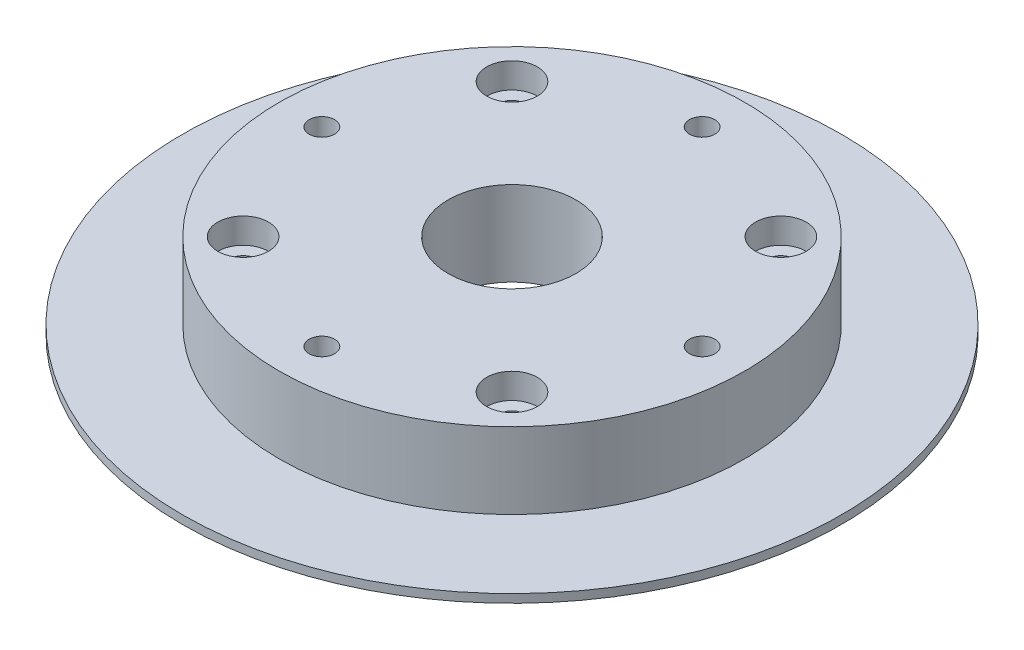
from build123d import *

# Parameters (mm, degrees)
SKETCH1_R           = 39
SKETCH1_R_2         = 1.5
SKETCH1_R_3         = 7.5635
BOSS_EXTRUDE1_DEPTH = 1
BOSS_EXTRUDE2_START = 9
SKETCH1_3_R         = 27.55
SKETCH1_3_R_2       = 1.5
SKETCH1_3_R_3       = 7.5635
BOSS_EXTRUDE2_DEPTH = 9
SKETCH2_R           = 3
SKETCH2_R_2         = 1.5
CUT_EXTRUDE1_DEPTH  = 3


with BuildPart() as part:
    # Sketch1 → Boss-Extrude1 (new body)
    with BuildSketch(Plane(origin=(0, 0, 0), x_dir=(1, 0, 0), z_dir=(0, 1, 0))):
        Circle(SKETCH1_R)
        with Locations((22.5, 0)):
            Circle(SKETCH1_R_2, mode=Mode.SUBTRACT)
        with Locations((-15.909902577, -15.909902577)):
            Circle(SKETCH1_R_2, mode=Mode.SUBTRACT)
        with Locations((0, -22.5)):
            Circle(SKETCH1_R_2, mode=Mode.SUBTRACT)
        with Locations((15.909902577, -15.909902577)):
            Circle(SKETCH1_R_2, mode=Mode.SUBTRACT)
        with Locations((-22.5, 0)):
            Circle(SKETCH1_R_2, mode=Mode.SUBTRACT)
        with Locations((-15.909902577, 15.909902577)):
            Circle(SKETCH1_R_2, mode=Mode.SUBTRACT)
        with Locations((0, 22.5)):
            Circle(SKETCH1_R_2, mode=Mode.SUBTRACT)
        Circle(SKETCH1_R_3, mode=Mode.SUBTRACT)
        with Locations((15.909902577, 15.909902577)):
            Circle(SKETCH1_R_2, mode=Mode.SUBTRACT)
    extrude(amount=-BOSS_EXTRUDE1_DEPTH)

    # Sketch1<3> → Boss-Extrude2 (add)
    with BuildSketch(Plane(origin=(0, 0, 0), x_dir=(1, 0, 0), z_dir=(0, 1, 0)).offset(BOSS_EXTRUDE2_START)):
        Circle(SKETCH1_3_R)
        with Locations((-15.909902577, -15.909902577)):
            Circle(SKETCH1_3_R_2, mode=Mode.SUBTRACT)
        with Locations((0, -22.5)):
            Circle(SKETCH1_3_R_2, mode=Mode.SUBTRACT)
        with Locations((15.909902577, -15.909902577)):
            Circle(SKETCH1_3_R_2, mode=Mode.SUBTRACT)
        with Locations((-22.5, 0)):
            Circle(SKETCH1_3_R_2, mode=Mode.SUBTRACT)
        with Locations((-15.909902577, 15.909902577)):
            Circle(SKETCH1_3_R_2, mode=Mode.SUBTRACT)
        with Locations((0, 22.5)):
            Circle(SKETCH1_3_R_2, mode=Mode.SUBTRACT)
        Circle(SKETCH1_3_R_3, mode=Mode.SUBTRACT)
        with Locations((15.909902577, 15.909902577)):
            Circle(SKETCH1_3_R_2, mode=Mode.SUBTRACT)
        with Locations((22.5, 0)):
            Circle(SKETCH1_3_R_2, mode=Mode.SUBTRACT)
    extrude(amount=-BOSS_EXTRUDE2_DEPTH)

    # Sketch2 → Cut-Extrude1 (cut)
    # profile 1 of 4: a face of its own
    with BuildSketch(Plane(origin=(0, 9, 0), x_dir=(1, 0, 0), z_dir=(0, 1, 0))):
        with Locations((15.909902577, 15.909902577)):
            Circle(SKETCH2_R)
        with Locations((15.909902577, 15.909902577)):
            Circle(SKETCH2_R_2, mode=Mode.SUBTRACT)
    # profile 2 of 4: a face of its own
    with BuildSketch(Plane(origin=(0, 9, 0), x_dir=(1, 0, 0), z_dir=(0, 1, 0))):
        with Locations((15.909902577, -15.909902577)):
            Circle(SKETCH2_R)
    # profile 3 of 4: a face of its own
    with BuildSketch(Plane(origin=(0, 9, 0), x_dir=(1, 0, 0), z_dir=(0, 1, 0))):
        with Locations((-15.909902577, -15.909902577)):
            Circle(SKETCH2_R)
        with Locations((-15.909902577, -15.909902577)):
            Circle(SKETCH2_R_2, mode=Mode.SUBTRACT)
    # profile 4 of 4: a face of its own
    with BuildSketch(Plane(origin=(0, 9, 0), x_dir=(1, 0, 0), z_dir=(0, 1, 0))):
        with Locations((-15.909902577, 15.909902577)):
            Circle(SKETCH2_R)
        with Locations((-15.909902577, 15.909902577)):
            Circle(SKETCH2_R_2, mode=Mode.SUBTRACT)
    extrude(amount=-CUT_EXTRUDE1_DEPTH, mode=Mode.SUBTRACT)


solid = part.part
